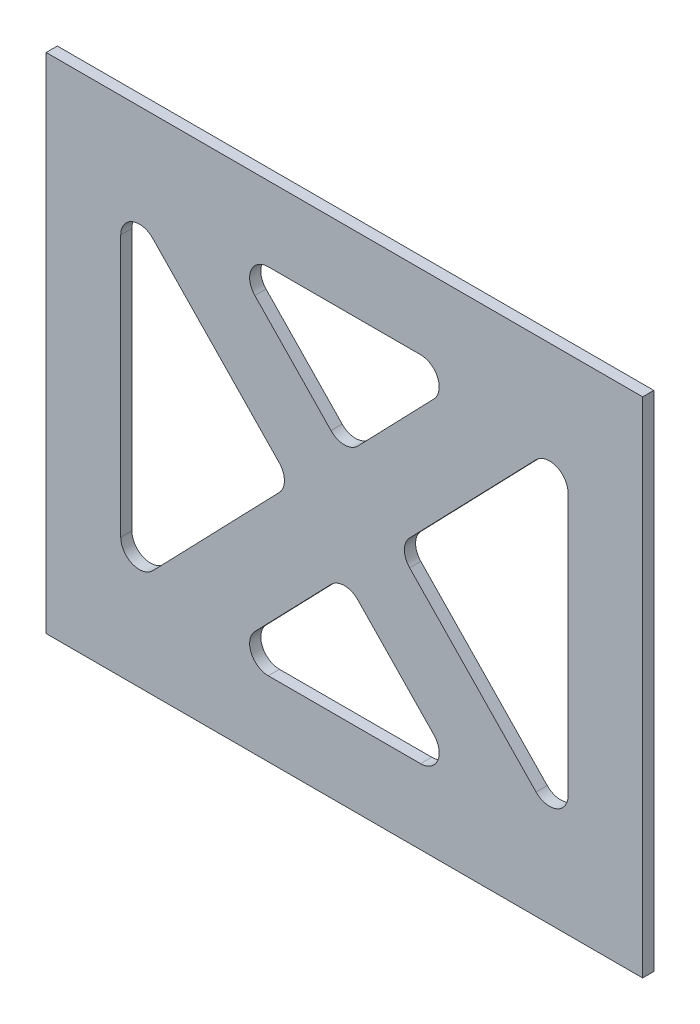
from build123d import *

# Parameters (mm, degrees)
SKETCH1_W           = 160
SKETCH1_H           = 135
BOSS_EXTRUDE1_DEPTH = 3


with BuildPart() as part:
    # Sketch1 → Boss-Extrude1 (new body)
    with BuildSketch(Plane.XY.offset(152)):
        with Locations((0, 12.91714511)):
            Rectangle(SKETCH1_W, SKETCH1_H)
        with BuildLine():
            Line((-60, -22.204596664), (-60, 48.038886885))
            ThreePointArc((-60, 48.038886885), (-56.872665603, 52.674954566), (-51.402750584, 51.511608676))
            Line((-51.402750584, 51.511608676), (-17.49683417, 16.389866902))
            ThreePointArc((-17.49683417, 16.389866902), (-16.094083586, 12.91714511), (-17.49683417, 9.444423319))
            Line((-17.49683417, 9.444423319), (-51.402750584, -25.677318456))
            ThreePointArc((-51.402750584, -25.677318456), (-56.872665603, -26.840664345), (-60, -22.204596664))
        make_face(mode=Mode.SUBTRACT)
        with BuildLine():
            Line((20.424315219, 60.41714511), (-20.424315219, 60.41714511))
            ThreePointArc((-20.424315219, 60.41714511), (-25.026684661, 57.371165459), (-24.021564635, 51.944423319))
            Line((-24.021564635, 51.944423319), (-3.597249416, 30.787716735))
            ThreePointArc((-3.597249416, 30.787716735), (0, 29.260438526), (3.597249416, 30.787716735))
            Line((3.597249416, 30.787716735), (24.021564635, 51.944423319))
            ThreePointArc((24.021564635, 51.944423319), (25.026684661, 57.371165459), (20.424315219, 60.41714511))
        make_face(mode=Mode.SUBTRACT)
        with BuildLine():
            Line((51.402750584, 51.511608676), (17.49683417, 16.389866902))
            ThreePointArc((17.49683417, 16.389866902), (16.094083586, 12.91714511), (17.49683417, 9.444423319))
            Line((17.49683417, 9.444423319), (51.402750584, -25.677318456))
            ThreePointArc((51.402750584, -25.677318456), (56.872665603, -26.840664345), (60, -22.204596664))
            Line((60, -22.204596664), (60, 48.038886885))
            ThreePointArc((60, 48.038886885), (56.872665603, 52.674954566), (51.402750584, 51.511608676))
        make_face(mode=Mode.SUBTRACT)
        with BuildLine():
            Line((-24.021564635, -26.110133098), (-3.597249416, -4.953426514))
            ThreePointArc((-3.597249416, -4.953426514), (0, -3.426148305), (3.597249416, -4.953426514))
            Line((3.597249416, -4.953426514), (24.021564635, -26.110133098))
            ThreePointArc((24.021564635, -26.110133098), (25.026684661, -31.536875238), (20.424315219, -34.58285489))
            Line((20.424315219, -34.58285489), (-20.424315219, -34.58285489))
            ThreePointArc((-20.424315219, -34.58285489), (-25.026684661, -31.536875238), (-24.021564635, -26.110133098))
        make_face(mode=Mode.SUBTRACT)
    extrude(amount=BOSS_EXTRUDE1_DEPTH)


solid = part.part
